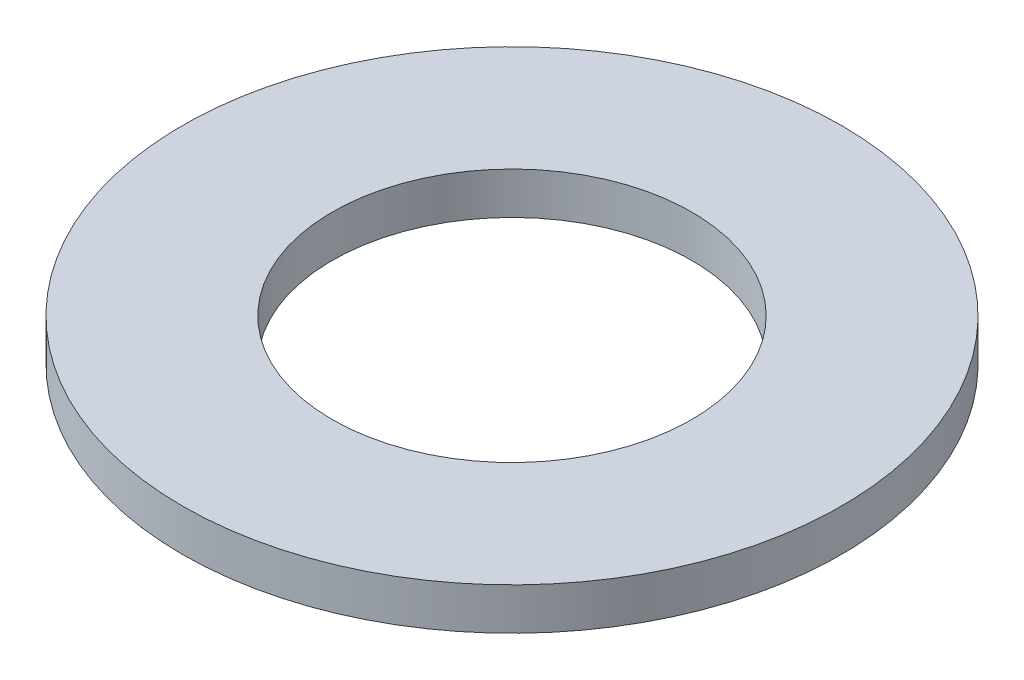
from build123d import *

# Parameters (mm, degrees)
SKETCH1_R           = 55
BOSS_EXTRUDE1_DEPTH = 7
SKETCH2_R           = 30
CUT_EXTRUDE1_DEPTH  = 79.096094653


with BuildPart() as part:
    # Sketch1 → Boss-Extrude1 (new body)
    with BuildSketch(Plane(origin=(0, 0, 0), x_dir=(1, 0, 0), z_dir=(0, 1, 0))):
        Circle(SKETCH1_R)
    extrude(amount=BOSS_EXTRUDE1_DEPTH)

    # Sketch2 → Cut-Extrude1 (cut, through all)
    with BuildSketch(Plane(origin=(0, 0, 0), x_dir=(1, 0, 0), z_dir=(0, 1, 0))):
        Circle(SKETCH2_R)
    extrude(amount=CUT_EXTRUDE1_DEPTH, mode=Mode.SUBTRACT)


solid = part.part
